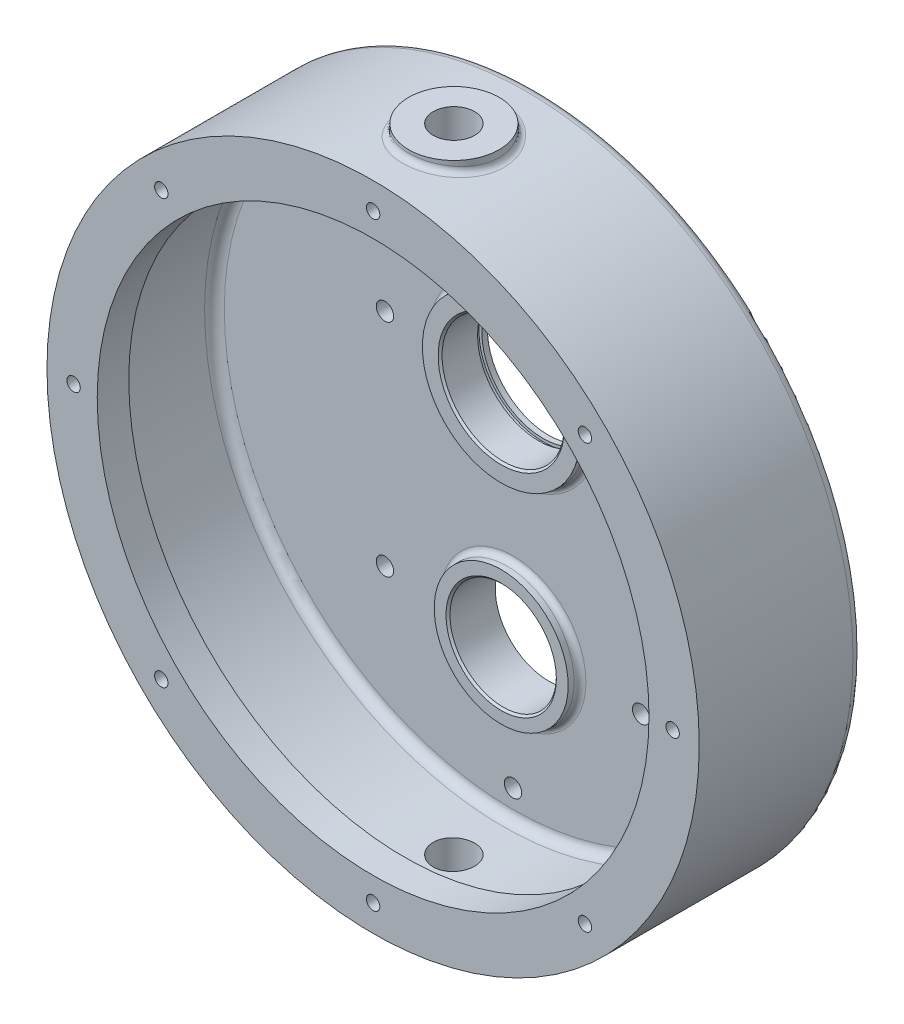
from build123d import *

# Parameters (mm, degrees)
SKETCH_1_R               = 165.5
EXTRUDE_1_DEPTH          = 83
SKETCH_2_R               = 140
CUT_EXTRUDE_1_DEPTH      = 71
SKETCH_3_R               = 151.5
CUT_EXTRUDE_2_DEPTH      = 55
FILLET_1_R               = 5
FILLET_2_R               = 5
HOLE_WIZARD_M8_1_D       = 6.8
HOLE_WIZARD_M8_1_DEPTH   = 12.957073895
HOLE_WIZARD_M8_1_TIP     = 2.042926105
EXTRUDE_2_REACH          = 420.333
EXTRUDE_2_END_RADIUS     = 165.5
EXTRUDE_START            = 170
SKETCH_6_R               = 23
HOLE_WIZARD_M24_1_REACH  = 385.196
HOLE_WIZARD_M24_1_BORE_R = 10.5
FILLET_3_R               = 3
FILLET_3_OF_MIRROR_1_R   = 3
EXTRUDE_4_DEPTH          = 6
FILLET_4_R               = 3
SKETCH_11_R              = 40
EXTRUDE_5_DEPTH          = 6
SKETCH_12_R              = 34
EXTRUDE_6_DEPTH          = 6
FILLET_5_R               = 3
SKETCH_13_R              = 27
CUT_EXTRUDE_3_DEPTH      = 246.998475768
SKETCH_14_R              = 31
CUT_EXTRUDE_4_DEPTH      = 246.998475768
CUT_EXTRUDE_START        = -5
CUT_EXTRUDE_5_OUTLINE_R  = 32.5
CUT_EXTRUDE_5_DEPTH      = 2.2
CHAMFER_1_SIZE           = 1
SKETCH_16_R              = 50
SKETCH_16_R_2            = 34
CUT_EXTRUDE_6_DEPTH      = 6
FILLET_6_R               = 3
HOLE_START               = -6
HOLE_WIZARD_1_OUTLINE_R  = 4.4
HOLE_WIZARD_1_DEPTH      = 18


# Read off the part's stored shape, not the designer's step: 切除-拉伸5, 孔1
with BuildPart() as part:
    # 草图1 → 凸台-拉伸1 (new body)
    with BuildSketch(Plane.XY):
        Circle(SKETCH_1_R)
    extrude(amount=EXTRUDE_1_DEPTH)

    # 草图2 → 切除-拉伸1 (cut)
    with BuildSketch(Plane.XY.offset(83)):
        Circle(SKETCH_2_R)
    extrude(amount=-CUT_EXTRUDE_1_DEPTH, mode=Mode.SUBTRACT)

    # 草图3 → 切除-拉伸2 (cut)
    with BuildSketch(Plane.XY.offset(12)):
        Circle(SKETCH_3_R)
    extrude(amount=CUT_EXTRUDE_2_DEPTH, mode=Mode.SUBTRACT)

    # 圆角1
    fillet_1_edges = [part.edges().sort_by_distance(p)[0] for p in [
        (-165.5, 0, 0),
    ]]
    fillet(fillet_1_edges, radius=FILLET_1_R)

    # 圆角2
    fillet_2_edges = [part.edges().sort_by_distance(p)[0] for p in [
        (-151.5, 0, 67),
        (-151.5, 0, 12),
    ]]
    fillet(fillet_2_edges, radius=FILLET_2_R)

    # M8 螺纹孔1
    with Locations(Plane.XY.offset(83)):
        with Locations((107.48023074, 107.48023074), (152, 0), (107.48023074, -107.48023074), (0, -152), (-107.48023074, -107.48023074), (-152, 0), (-107.48023074, 107.48023074), (0, 152)):
            Hole(HOLE_WIZARD_M8_1_D / 2, depth=HOLE_WIZARD_M8_1_DEPTH)
            with Locations((0, 0, -(HOLE_WIZARD_M8_1_DEPTH + HOLE_WIZARD_M8_1_TIP / 2))):  # 118° drill point
                Cone(0, HOLE_WIZARD_M8_1_D / 2, HOLE_WIZARD_M8_1_TIP, mode=Mode.SUBTRACT)

    # 凸台-拉伸2: up to this cylinder (the profile starts outside it)
    extrude_2_end = Plane(origin=(0, 0, 42), z_dir=(0, 0, -1)) * Cylinder(EXTRUDE_2_END_RADIUS, 1172.666, mode=Mode.PRIVATE)
    # 草图6 → 凸台-拉伸2 (add, up to the surface)
    with BuildSketch(Plane(origin=(0, 0, 0), x_dir=(1, 0, 0), z_dir=(0, 1, 0)).offset(EXTRUDE_START), mode=Mode.PRIVATE) as extrude_2_sk1:
        with Locations(Location((0, -42, 0), (0, 0, 270))):
            Circle(SKETCH_6_R)
    extrude_2_tool1 = extrude(extrude_2_sk1.sketch, amount=-EXTRUDE_2_REACH, mode=Mode.PRIVATE) - extrude_2_end
    extrude_2 = extrude_2_tool1.solids().sort_by_distance((0, 170, 42))[0]
    add(extrude_2)

    # M24 螺纹孔1 bore → M24 螺纹孔1 (cut, up to next)
    with BuildSketch(Plane(origin=(0, 170, 0), x_dir=(1, 0, 0), z_dir=(0, 1, 0)), mode=Mode.PRIVATE) as hole_wizard_m24_1_sk1:
        with Locations((0, -42)):
            Circle(HOLE_WIZARD_M24_1_BORE_R)
    hole_wizard_m24_1_tool1 = extrude(hole_wizard_m24_1_sk1.sketch, amount=-HOLE_WIZARD_M24_1_REACH, mode=Mode.PRIVATE) & part.part
    hole_wizard_m24_1 = hole_wizard_m24_1_tool1.solids().sort_by_distance((0, 170, 42))[0]
    add(hole_wizard_m24_1, mode=Mode.SUBTRACT)

    # 圆角3
    fillet_3_edges = [part.edges().sort_by_distance(p)[0] for p in [
        (5e-09, 165.499999999, 18.999999996),
    ]]
    fillet(fillet_3_edges, radius=FILLET_3_R)

    # 镜向1: 凸台-拉伸2, M24 螺纹孔1 across plane
    add(extrude_2.mirror(Plane.ZX))
    add(hole_wizard_m24_1.mirror(Plane.ZX), mode=Mode.SUBTRACT)

    # 圆角3 of 镜向1
    fillet_3_of_mirror_1_edges = [part.edges().sort_by_distance(p)[0] for p in [
        (5e-09, -165.499999999, 18.999999996),
    ]]
    fillet(fillet_3_of_mirror_1_edges, radius=FILLET_3_OF_MIRROR_1_R)

    # 草图9 → 凸台-拉伸4 (add)
    with BuildSketch(Plane(origin=(0, 0, 0), x_dir=(-1, 0, 0), z_dir=(0, 0, -1))):
        with BuildLine():
            Line((76, 40), (76, -72))
            ThreePointArc((76, -72), (0, -148), (-76, -72))
            Line((-76, -72), (-76, 40))
            ThreePointArc((-76, 40), (0, 116), (76, 40))
        make_face()
    extrude(amount=EXTRUDE_4_DEPTH)

    # 圆角4
    fillet_4_edges = [part.edges().sort_by_distance(p)[0] for p in [
        (0, 116, 0),
        (76, -16, 0),
        (0, -148, 0),
        (-76, -16, 0),
    ]]
    fillet(fillet_4_edges, radius=FILLET_4_R)

    # 草图11 → 凸台-拉伸5 (add)
    with BuildSketch(Plane.XY.offset(12)):
        with Locations((0, 40)):
            Circle(SKETCH_11_R)
    extrude(amount=EXTRUDE_5_DEPTH)

    # 草图12 → 凸台-拉伸6 (add)
    with BuildSketch(Plane.XY.offset(12)):
        with Locations((0, -72)):
            Circle(SKETCH_12_R)
    extrude(amount=EXTRUDE_6_DEPTH)

    # 圆角5
    fillet_5_edges = [part.edges().sort_by_distance(p)[0] for p in [
        (-40, 40, 12),
        (-34, -72, 12),
    ]]
    fillet(fillet_5_edges, radius=FILLET_5_R)

    # 草图13 → 切除-拉伸3 (cut, through all)
    with BuildSketch(Plane.XY.offset(18)):
        with Locations((0, -72)):
            Circle(SKETCH_13_R)
    extrude(amount=-CUT_EXTRUDE_3_DEPTH, mode=Mode.SUBTRACT)

    # 草图14 → 切除-拉伸4 (cut, through all)
    with BuildSketch(Plane.XY.offset(18)):
        with Locations((0, 40)):
            Circle(SKETCH_14_R)
    extrude(amount=-CUT_EXTRUDE_4_DEPTH, mode=Mode.SUBTRACT)

    # 切除-拉伸5 outline → 切除-拉伸5 (cut)
    with BuildSketch(Plane(origin=(0, 0, -6), x_dir=(-1, 0, 0), z_dir=(0, 0, -1)).offset(CUT_EXTRUDE_START)):
        with Locations((0, 40)):
            Circle(CUT_EXTRUDE_5_OUTLINE_R)
    extrude(amount=CUT_EXTRUDE_5_DEPTH, mode=Mode.SUBTRACT)

    # 倒角1
    chamfer_1_edges = [part.edges().sort_by_distance(p)[0] for p in [
        (-27, -72, 18),
        (-31, 40, 18),
    ]]
    chamfer(chamfer_1_edges, length=CHAMFER_1_SIZE)

    # 草图16 → 切除-拉伸6 (cut)
    with BuildSketch(Plane(origin=(0, 0, -6), x_dir=(-1, 0, 0), z_dir=(0, 0, -1))):
        with Locations((0, -72)):
            Circle(SKETCH_16_R)
        with Locations(Location((0, -72, 0), (0, 0, 180))):
            Circle(SKETCH_16_R_2, mode=Mode.SUBTRACT)
    extrude(amount=-CUT_EXTRUDE_6_DEPTH, mode=Mode.SUBTRACT)

    # 圆角6
    fillet_6_edges = [part.edges().sort_by_distance(p)[0] for p in [
        (50, -72, 0),
        (-34, -72, 0),
    ]]
    fillet(fillet_6_edges, radius=FILLET_6_R)

    # 孔1 outline → 孔1 (cut)
    with BuildSketch(Plane.XY.offset(HOLE_START)):
        with Locations((0, -137)):
            Circle(HOLE_WIZARD_1_OUTLINE_R)
        with Locations((0, 105)):
            Circle(HOLE_WIZARD_1_OUTLINE_R)
        with Locations((65, -72)):
            Circle(HOLE_WIZARD_1_OUTLINE_R)
        with Locations((65, 40)):
            Circle(HOLE_WIZARD_1_OUTLINE_R)
        with Locations((-65, -72)):
            Circle(HOLE_WIZARD_1_OUTLINE_R)
        with Locations((-65, 40)):
            Circle(HOLE_WIZARD_1_OUTLINE_R)
    extrude(amount=HOLE_WIZARD_1_DEPTH, mode=Mode.SUBTRACT)


solid = part.part
